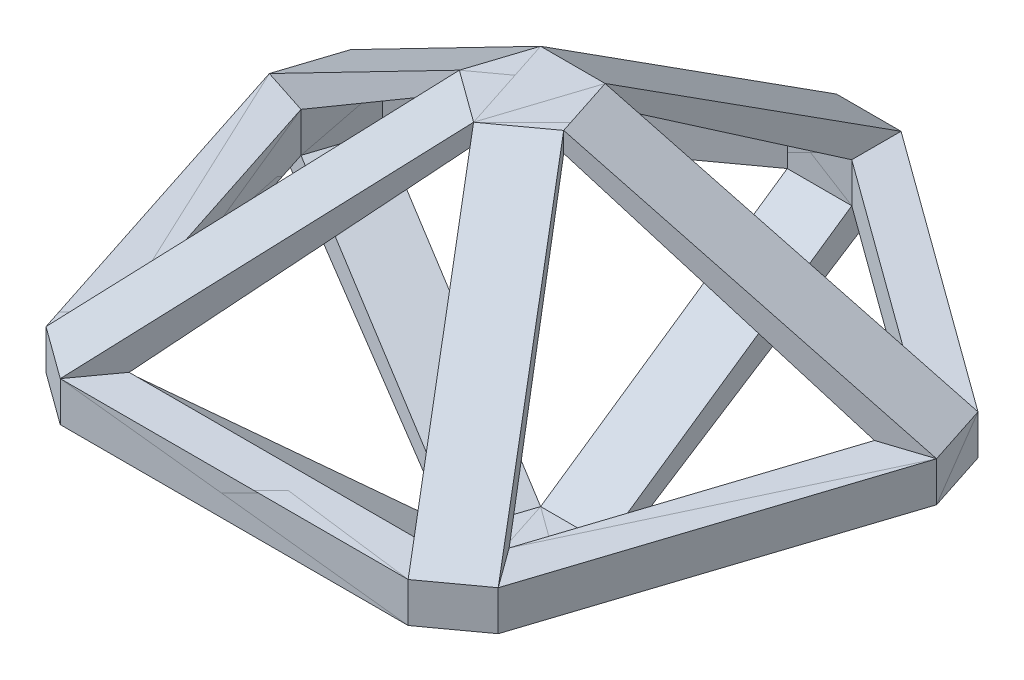
from build123d import *

# Parameters (mm, degrees)
EXTRUDE_1_DEPTH          = 5
EXTRUDE_2_DEPTH          = 2.5
LOFT_START               = -8.090169944
LOFT_1_DEPTH             = 16.180339888
PATTERN_CIRCULAR_7_COUNT = 5


# Read off the part's stored shape, not the designer's step: 放样1
with BuildPart() as part:
    # 草图1 → 凸台-拉伸1 (new, symmetric)
    with BuildSketch(Plane(origin=(0, 0, 0), x_dir=(1, 0, 0), z_dir=(0, 1, 0))):
        Polygon((78.689382017, 34.074238185), (8.090169944, 85.3675682), (-8.090169944, 85.3675682), (-78.689382017, 34.074238185), (-83.689382017, 18.685820499), (-56.722882584, -64.308530861), (-43.63271264, -73.819096024), (43.63271264, -73.819096024), (56.722882584, -64.308530861), (83.689382017, 18.685820499), align=None)
        Polygon((66.933676971, 30.254578073), (8.090169944, 73.006888425), (-8.090169944, 73.006888425), (-66.933676971, 30.254578073), (-71.933676971, 14.866160387), (-49.457457304, -54.308530861), (-36.36728736, -63.819096024), (36.36728736, -63.819096024), (49.457457304, -54.308530861), (71.933676971, 14.866160387), align=None, mode=Mode.SUBTRACT)
    extrude(amount=EXTRUDE_1_DEPTH, both=True)



with BuildPart() as body_2:
    # 草图3 → 凸台-拉伸2 (new, symmetric)
    with BuildSketch(Plane(origin=(0, 50, 0), x_dir=(1, 0, 0), z_dir=(0, 1, 0))):
        Polygon((8.090169944, 11.135163644), (-8.090169944, 11.135163644), (-13.090169944, -4.253254042), (0, -13.763819205), (13.090169944, -4.253254042), align=None)
    extrude(amount=EXTRUDE_2_DEPTH, both=True)


with BuildPart() as part_1:
    add(part.part)

    add(body_2.part)  # 放样1 merges body 2
    # 放样1 outline → 放样1 (add)
    with BuildSketch(Plane(origin=(0, 0, 0), x_dir=(0.5877852522924731, 0, -0.8090169943749473), z_dir=(0.8090169943749473, 0, 0.5877852522924732)).offset(LOFT_START)):
        Polygon((-11.135163644, 52.5), (-85.3675682, 5), (-73.006888425, 5), (-11.135163644, 47.5), align=None)
    extrude(amount=LOFT_1_DEPTH)


with BuildPart() as pattern_circular_7_1:
    # 阵列(圆周)7: pattern copy
    add(part_1.part.rotate(Axis((0, 0, 0), (0, 1, 0)), 1 * 360 / PATTERN_CIRCULAR_7_COUNT))


with BuildPart() as pattern_circular_7_2:
    # 阵列(圆周)7: pattern copy
    add(part_1.part.rotate(Axis((0, 0, 0), (0, 1, 0)), 2 * 360 / PATTERN_CIRCULAR_7_COUNT))


with BuildPart() as pattern_circular_7_3:
    # 阵列(圆周)7: pattern copy
    add(part_1.part.rotate(Axis((0, 0, 0), (0, 1, 0)), 3 * 360 / PATTERN_CIRCULAR_7_COUNT))


with BuildPart() as pattern_circular_7_4:
    # 阵列(圆周)7: pattern copy
    add(part_1.part.rotate(Axis((0, 0, 0), (0, 1, 0)), 4 * 360 / PATTERN_CIRCULAR_7_COUNT))


with BuildPart() as body_6:
    # 镜向1: mirrored copy
    add(pattern_circular_7_1.part.mirror(Plane.ZX))


with BuildPart() as body_7:
    # Mirror 1 2: mirrored copy
    add(pattern_circular_7_2.part.mirror(Plane.ZX))


with BuildPart() as body_8:
    # Mirror 1 3: mirrored copy
    add(part_1.part.mirror(Plane.ZX))


with BuildPart() as body_9:
    # Mirror 1 4: mirrored copy
    add(pattern_circular_7_3.part.mirror(Plane.ZX))


with BuildPart() as body_10:
    # Mirror 1 5: mirrored copy
    add(pattern_circular_7_4.part.mirror(Plane.ZX))


solid = Compound([part_1.part, pattern_circular_7_1.part, pattern_circular_7_2.part, pattern_circular_7_3.part, pattern_circular_7_4.part, body_6.part, body_7.part, body_8.part, body_9.part, body_10.part])
